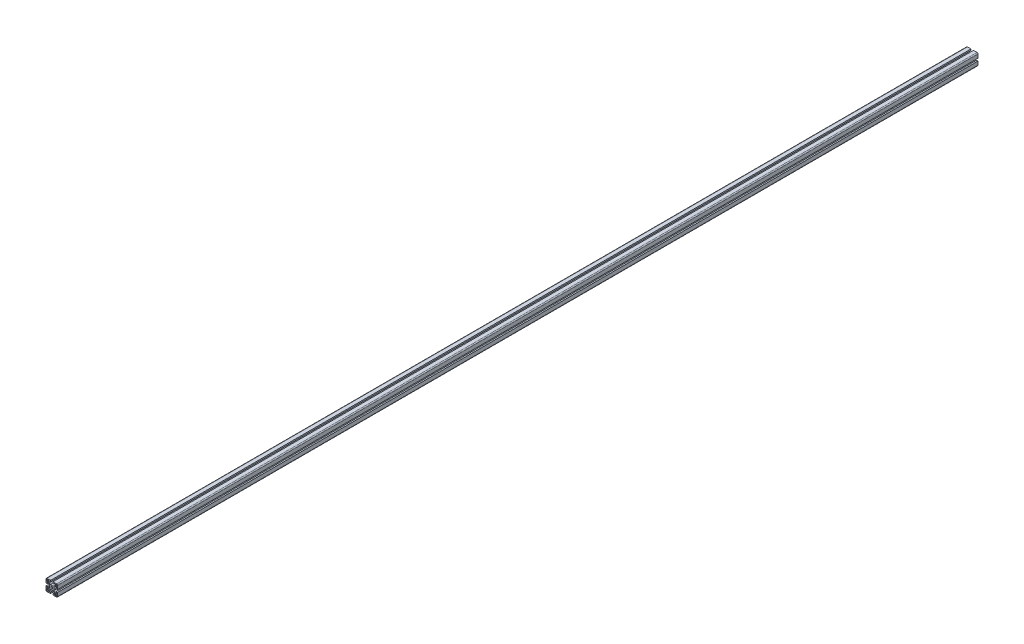
from build123d import *

# Parameters (mm, degrees)
SKETCH1_R           = 3.2639
BOSS_EXTRUDE1_DEPTH = 1524


with BuildPart() as part:
    # Sketch1 → Boss-Extrude1 (new, symmetric)
    with BuildSketch(Plane.XY):
        with BuildLine():
            Line((-6.731, 4.575738531), (-6.731, -4.575738531))
            Line((-6.731, -4.575738531), (-12.442261469, -10.287))
            Line((-12.442261469, -10.287), (-15.6718, -10.287))
            Line((-15.6718, -10.287), (-15.6718, -6.858))
            Line((-15.6718, -6.858), (-14.478, -6.858))
            Line((-14.478, -6.858), (-14.478, -4.064))
            Line((-14.478, -4.064), (-19.05, -4.064))
            Line((-19.05, -4.064), (-19.05, -15.875))
            ThreePointArc((-19.05, -15.875), (-18.12006403, -18.12006403), (-15.875, -19.05))
            Line((-15.875, -19.05), (-4.064, -19.05))
            Line((-4.064, -19.05), (-4.064, -14.478))
            Line((-4.064, -14.478), (-6.858, -14.478))
            Line((-6.858, -14.478), (-6.858, -15.6718))
            Line((-6.858, -15.6718), (-10.287, -15.6718))
            Line((-10.287, -15.6718), (-10.287, -12.442261469))
            Line((-10.287, -12.442261469), (-4.575738531, -6.731))
            Line((-4.575738531, -6.731), (4.575738531, -6.731))
            Line((4.575738531, -6.731), (10.287, -12.442261469))
            Line((10.287, -12.442261469), (10.287, -15.6718))
            Line((10.287, -15.6718), (6.858, -15.6718))
            Line((6.858, -15.6718), (6.858, -14.478))
            Line((6.858, -14.478), (4.064, -14.478))
            Line((4.064, -14.478), (4.064, -19.05))
            Line((4.064, -19.05), (15.875, -19.05))
            ThreePointArc((15.875, -19.05), (18.12006403, -18.12006403), (19.05, -15.875))
            Line((19.05, -15.875), (19.05, -4.064))
            Line((19.05, -4.064), (14.478, -4.064))
            Line((14.478, -4.064), (14.478, -6.858))
            Line((14.478, -6.858), (15.6718, -6.858))
            Line((15.6718, -6.858), (15.6718, -10.287))
            Line((15.6718, -10.287), (12.442261469, -10.287))
            Line((12.442261469, -10.287), (6.731, -4.575738531))
            Line((6.731, -4.575738531), (6.731, 4.575738531))
            Line((6.731, 4.575738531), (12.442261469, 10.287))
            Line((12.442261469, 10.287), (15.6718, 10.287))
            Line((15.6718, 10.287), (15.6718, 6.858))
            Line((15.6718, 6.858), (14.478, 6.858))
            Line((14.478, 6.858), (14.478, 4.064))
            Line((14.478, 4.064), (19.05, 4.064))
            Line((19.05, 4.064), (19.05, 15.875))
            ThreePointArc((19.05, 15.875), (18.12006403, 18.12006403), (15.875, 19.05))
            Line((15.875, 19.05), (4.064, 19.05))
            Line((4.064, 19.05), (4.064, 14.478))
            Line((4.064, 14.478), (6.858, 14.478))
            Line((6.858, 14.478), (6.858, 15.6718))
            Line((6.858, 15.6718), (10.287, 15.6718))
            Line((10.287, 15.6718), (10.287, 12.442261469))
            Line((10.287, 12.442261469), (4.575738531, 6.731))
            Line((4.575738531, 6.731), (-4.575738531, 6.731))
            Line((-4.575738531, 6.731), (-10.287, 12.442261469))
            Line((-10.287, 12.442261469), (-10.287, 15.6718))
            Line((-10.287, 15.6718), (-6.858, 15.6718))
            Line((-6.858, 15.6718), (-6.858, 14.478))
            Line((-6.858, 14.478), (-4.064, 14.478))
            Line((-4.064, 14.478), (-4.064, 19.05))
            Line((-4.064, 19.05), (-15.875, 19.05))
            ThreePointArc((-15.875, 19.05), (-18.12006403, 18.12006403), (-19.05, 15.875))
            Line((-19.05, 15.875), (-19.05, 4.064))
            Line((-19.05, 4.064), (-14.478, 4.064))
            Line((-14.478, 4.064), (-14.478, 6.858))
            Line((-14.478, 6.858), (-15.6718, 6.858))
            Line((-15.6718, 6.858), (-15.6718, 10.287))
            Line((-15.6718, 10.287), (-12.442261469, 10.287))
            Line((-12.442261469, 10.287), (-6.731, 4.575738531))
        make_face()
        Circle(SKETCH1_R, mode=Mode.SUBTRACT)
        with BuildLine():
            Line((-11.8872, 17.272), (-14.478, 17.272))
            ThreePointArc((-14.478, 17.272), (-16.453656347, 16.453656347), (-17.272, 14.478))
            Line((-17.272, 14.478), (-17.272, 11.8872))
            Line((-17.272, 11.8872), (-11.8872, 11.8872))
            Line((-11.8872, 11.8872), (-11.8872, 17.272))
        make_face(mode=Mode.SUBTRACT)
        with BuildLine():
            Line((14.478, 17.272), (11.8872, 17.272))
            Line((11.8872, 17.272), (11.8872, 11.8872))
            Line((11.8872, 11.8872), (17.272, 11.8872))
            Line((17.272, 11.8872), (17.272, 14.478))
            ThreePointArc((17.272, 14.478), (16.453656347, 16.453656347), (14.478, 17.272))
        make_face(mode=Mode.SUBTRACT)
        with BuildLine():
            Line((11.8872, -17.272), (14.478, -17.272))
            ThreePointArc((14.478, -17.272), (16.453656347, -16.453656347), (17.272, -14.478))
            Line((17.272, -14.478), (17.272, -11.8872))
            Line((17.272, -11.8872), (11.8872, -11.8872))
            Line((11.8872, -11.8872), (11.8872, -17.272))
        make_face(mode=Mode.SUBTRACT)
        with BuildLine():
            Line((-14.478, -17.272), (-11.8872, -17.272))
            Line((-11.8872, -17.272), (-11.8872, -11.8872))
            Line((-11.8872, -11.8872), (-17.272, -11.8872))
            Line((-17.272, -11.8872), (-17.272, -14.478))
            ThreePointArc((-17.272, -14.478), (-16.453656347, -16.453656347), (-14.478, -17.272))
        make_face(mode=Mode.SUBTRACT)
    extrude(amount=BOSS_EXTRUDE1_DEPTH, both=True)


solid = part.part
